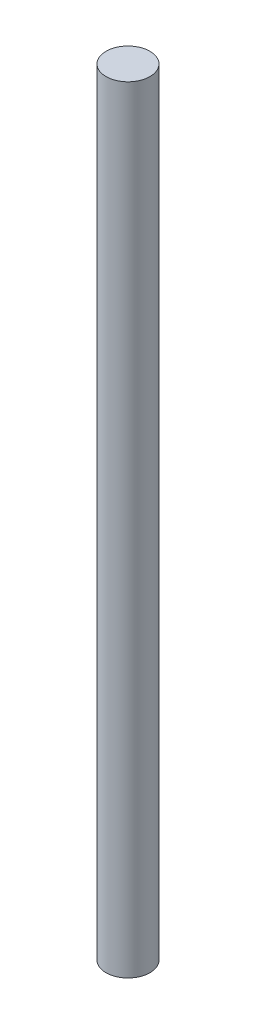
from build123d import *

# Parameters (mm, degrees)
SKETCH1_R           = 5.026321837
BOSS_EXTRUDE1_DEPTH = 177.8


with BuildPart() as part:
    # Sketch1 → Boss-Extrude1 (new body)
    with BuildSketch(Plane(origin=(0, 0, 0), x_dir=(1, 0, 0), z_dir=(0, 1, 0))):
        Circle(SKETCH1_R)
    extrude(amount=BOSS_EXTRUDE1_DEPTH)


solid = part.part
